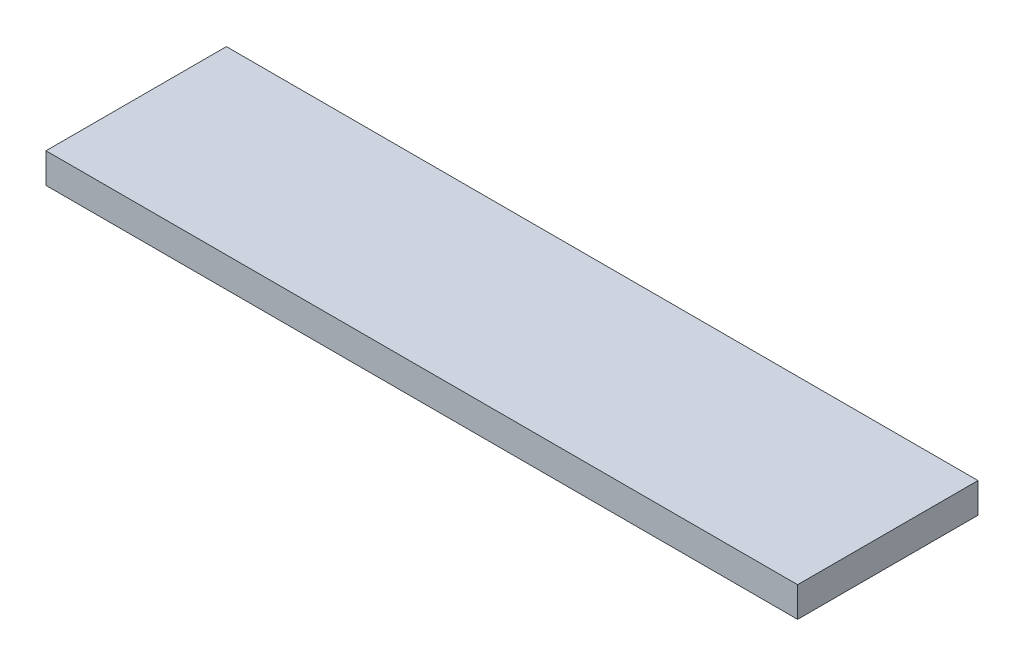
from build123d import *

# Parameters (mm, degrees)
SKETCH3_W           = 7620
SKETCH3_H           = 1828.8
BOSS_EXTRUDE3_DEPTH = 304.8


with BuildPart() as part:
    # Sketch3 → Boss-Extrude3 (new body)
    with BuildSketch(Plane(origin=(0, 0, 0), x_dir=(-1, 0, 0), z_dir=(0, 1, 0))):
        Rectangle(SKETCH3_W, SKETCH3_H)
    extrude(amount=BOSS_EXTRUDE3_DEPTH)


solid = part.part
